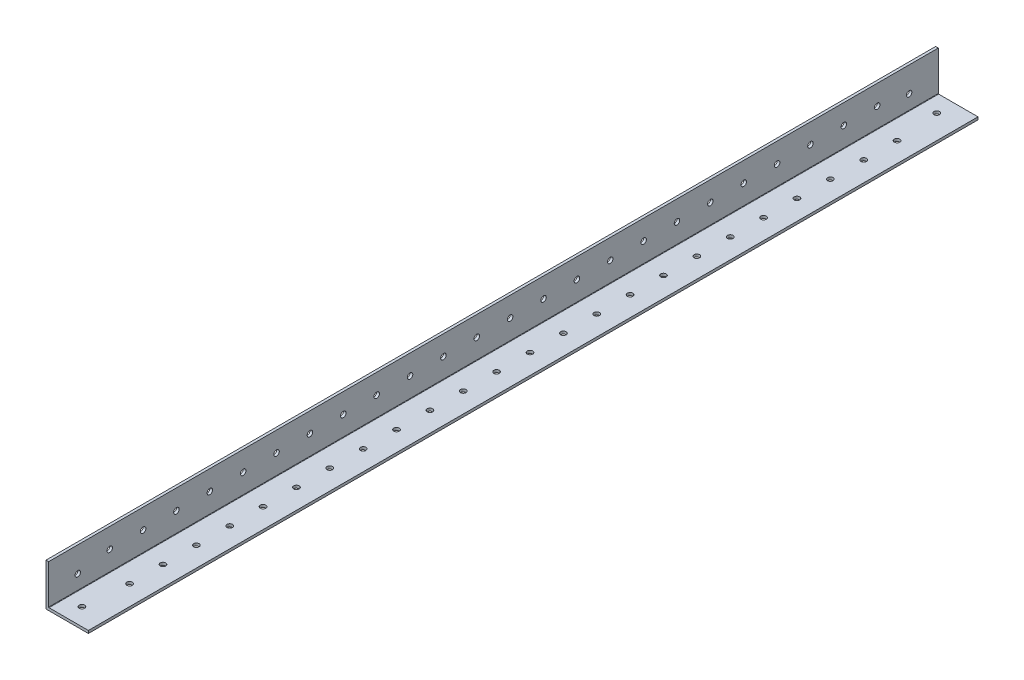
from build123d import *

# Parameters (mm, degrees)
BOSS_EXTRUDE1_DEPTH = 1219.2
FILLET1_R           = 0.254
SKETCH4_W           = 1905.2
SKETCH4_H           = 74.945320812
CUT_EXTRUDE1_DEPTH  = 60
SKETCH9_R           = 1.65
CUT_EXTRUDE5_DEPTH  = 60
SKETCH10_R          = 1.65
CUT_EXTRUDE6_DEPTH  = 60


with BuildPart() as part:
    # Sketch3 → Boss-Extrude1 (new, symmetric)
    with BuildSketch(Plane.XY):
        Polygon((1.5875, 25.4), (0, 25.4), (0, 0), (25.4, 0), (25.4, 1.5875), (1.5875, 1.5875), align=None)
    extrude(amount=BOSS_EXTRUDE1_DEPTH, both=True)

    # Fillet1
    fillet1_edges = [part.edges().sort_by_distance(p)[0] for p in [
        (1.5875, 1.5875, 0),
    ]]
    fillet(fillet1_edges, radius=FILLET1_R)

    # Sketch4 → Cut-Extrude1 (cut)
    with BuildSketch(Plane.ZY):
        with Locations((-266.6, 37.472660406)):
            Rectangle(SKETCH4_W, SKETCH4_H)
    extrude(amount=-CUT_EXTRUDE1_DEPTH, mode=Mode.SUBTRACT)

    # Sketch9 → Cut-Extrude5 (cut)
    with BuildSketch(Plane(origin=(1.5875, 0, 0), x_dir=(0, 0, -1), z_dir=(1, 0, 0))):
        with Locations((-1201.7375, 10.3759)):
            Circle(SKETCH9_R)
        with Locations((-703.4625, 10.3759)):
            Circle(SKETCH9_R)
        with Locations((-722.6, 13.49375)):
            Circle(SKETCH9_R)
        with Locations((-742.6, 13.49375)):
            Circle(SKETCH9_R)
        with Locations((-762.6, 13.49375)):
            Circle(SKETCH9_R)
        with Locations((-782.6, 13.49375)):
            Circle(SKETCH9_R)
        with Locations((-802.6, 13.49375)):
            Circle(SKETCH9_R)
        with Locations((-822.6, 13.49375)):
            Circle(SKETCH9_R)
        with Locations((-842.6, 13.49375)):
            Circle(SKETCH9_R)
        with Locations((-862.6, 13.49375)):
            Circle(SKETCH9_R)
        with Locations((-882.6, 13.49375)):
            Circle(SKETCH9_R)
        with Locations((-902.6, 13.49375)):
            Circle(SKETCH9_R)
        with Locations((-922.6, 13.49375)):
            Circle(SKETCH9_R)
        with Locations((-942.6, 13.49375)):
            Circle(SKETCH9_R)
        with Locations((-962.6, 13.49375)):
            Circle(SKETCH9_R)
        with Locations((-982.6, 13.49375)):
            Circle(SKETCH9_R)
        with Locations((-1002.6, 13.49375)):
            Circle(SKETCH9_R)
        with Locations((-1022.6, 13.49375)):
            Circle(SKETCH9_R)
        with Locations((-1042.6, 13.49375)):
            Circle(SKETCH9_R)
        with Locations((-1062.6, 13.49375)):
            Circle(SKETCH9_R)
        with Locations((-1082.6, 13.49375)):
            Circle(SKETCH9_R)
        with Locations((-1102.6, 13.49375)):
            Circle(SKETCH9_R)
        with Locations((-1122.6, 13.49375)):
            Circle(SKETCH9_R)
        with Locations((-1142.6, 13.49375)):
            Circle(SKETCH9_R)
        with Locations((-1162.6, 13.49375)):
            Circle(SKETCH9_R)
        with Locations((-1182.6, 13.49375)):
            Circle(SKETCH9_R)
    extrude(amount=-CUT_EXTRUDE5_DEPTH, mode=Mode.SUBTRACT)

    # Sketch10 → Cut-Extrude6 (cut)
    with BuildSketch(Plane(origin=(0, 1.5875, 0), x_dir=(1, 0, 0), z_dir=(0, 1, 0))):
        with Locations((11.1125, -696.408204333)):
            Circle(SKETCH10_R)
        with Locations((11.1125, -1208.791795667)):
            Circle(SKETCH10_R)
        with Locations((13.49375, -1182.6)):
            Circle(SKETCH10_R)
        with Locations((13.49375, -1162.6)):
            Circle(SKETCH10_R)
        with Locations((13.49375, -1142.6)):
            Circle(SKETCH10_R)
        with Locations((13.49375, -1122.6)):
            Circle(SKETCH10_R)
        with Locations((13.49375, -1102.6)):
            Circle(SKETCH10_R)
        with Locations((13.49375, -1082.6)):
            Circle(SKETCH10_R)
        with Locations((13.49375, -1062.6)):
            Circle(SKETCH10_R)
        with Locations((13.49375, -1042.6)):
            Circle(SKETCH10_R)
        with Locations((13.49375, -1022.6)):
            Circle(SKETCH10_R)
        with Locations((13.49375, -1002.6)):
            Circle(SKETCH10_R)
        with Locations((13.49375, -982.6)):
            Circle(SKETCH10_R)
        with Locations((13.49375, -962.6)):
            Circle(SKETCH10_R)
        with Locations((13.49375, -942.6)):
            Circle(SKETCH10_R)
        with Locations((13.49375, -922.6)):
            Circle(SKETCH10_R)
        with Locations((13.49375, -902.6)):
            Circle(SKETCH10_R)
        with Locations((13.49375, -882.6)):
            Circle(SKETCH10_R)
        with Locations((13.49375, -862.6)):
            Circle(SKETCH10_R)
        with Locations((13.49375, -842.6)):
            Circle(SKETCH10_R)
        with Locations((13.49375, -822.6)):
            Circle(SKETCH10_R)
        with Locations((13.49375, -802.6)):
            Circle(SKETCH10_R)
        with Locations((13.49375, -782.6)):
            Circle(SKETCH10_R)
        with Locations((13.49375, -762.6)):
            Circle(SKETCH10_R)
        with Locations((13.49375, -742.6)):
            Circle(SKETCH10_R)
        with Locations((13.49375, -722.6)):
            Circle(SKETCH10_R)
    extrude(amount=-CUT_EXTRUDE6_DEPTH, mode=Mode.SUBTRACT)


solid = part.part
